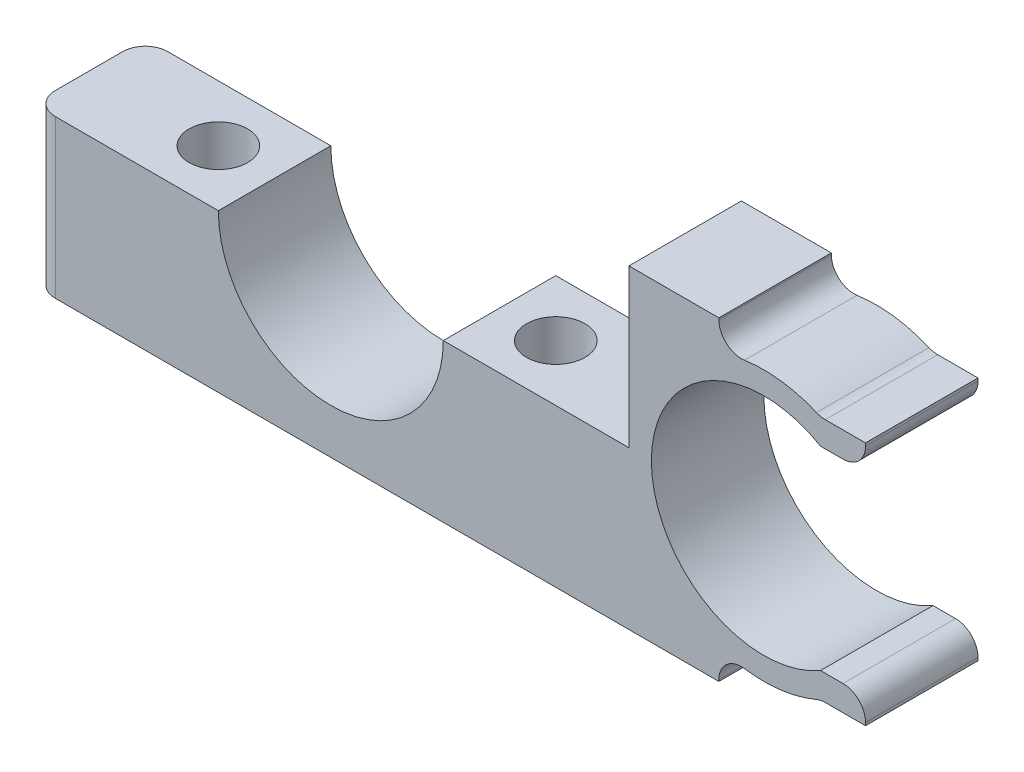
from build123d import *

# Parameters (mm, degrees)
BOSS_EXTRUDE1_DEPTH = 10
FILLET1_R           = 2
SKETCH4_R           = 2.6
CUT_EXTRUDE2_DEPTH  = 51.557996615


with BuildPart() as part:
    # Sketch1 → Boss-Extrude1 (new body)
    with BuildSketch(Plane.XY):
        with BuildLine():
            Line((10, 0), (26.5, 0))
            Line((26.5, 0), (26.5, 14))
            Line((26.5, 14), (34.5, 14))
            Line((34.5, 14), (34.5, 11.313708499))
            ThreePointArc((34.5, 11.313708499), (39.061789374, 11.986842482), (43.540624961, 10.89))
            Line((43.540624961, 10.89), (47.540624961, 10.89))
            Line((47.540624961, 10.89), (47.540624961, 8.636671813))
            Line((47.540624961, 8.636671813), (43.540624961, 8.636671813))
            ThreePointArc((43.540624961, 8.636671813), (28.5, 0), (43.540624961, -8.636671813))
            Line((43.540624961, -8.636671813), (47.540624961, -8.636671813))
            Line((47.540624961, -8.636671813), (47.540624961, -10.89))
            Line((47.540624961, -10.89), (43.540624961, -10.89))
            ThreePointArc((43.540624961, -10.89), (39.061789374, -11.986842482), (34.5, -11.313708499))
            Line((34.5, -11.313708499), (34.5, -14))
            Line((34.5, -14), (26.5, -14))
            Line((26.5, -14), (-26.5, -14))
            Line((-26.5, -14), (-26.5, 0))
            Line((-26.5, 0), (-10, 0))
            ThreePointArc((-10, 0), (0, -10), (10, 0))
        make_face()
    extrude(amount=BOSS_EXTRUDE1_DEPTH)

    # Fillet1
    fillet1_edges = [part.edges().sort_by_distance(p)[0] for p in [
        (47.540624961, -8.636671813, 5),
        (47.540624961, 8.636671813, 5),
        (-26.5, -7, 0),
        (-26.5, -7, 10),
        (43.540624961, 10.89, 5),
        (43.540624961, -10.89, 5),
        (34.5, -11.313708499, 5),
        (34.5, 11.313708499, 5),
    ]]
    fillet(fillet1_edges, radius=FILLET1_R)

    # Sketch4 → Cut-Extrude2 (cut, through all)
    with BuildSketch(Plane(origin=(0, 0, 0), x_dir=(1, 0, 0), z_dir=(0, 1, 0))):
        with Locations((-15, -5)):
            Circle(SKETCH4_R)
        with Locations((15, -5)):
            Circle(SKETCH4_R)
    extrude(amount=-CUT_EXTRUDE2_DEPTH, mode=Mode.SUBTRACT)


solid = part.part
